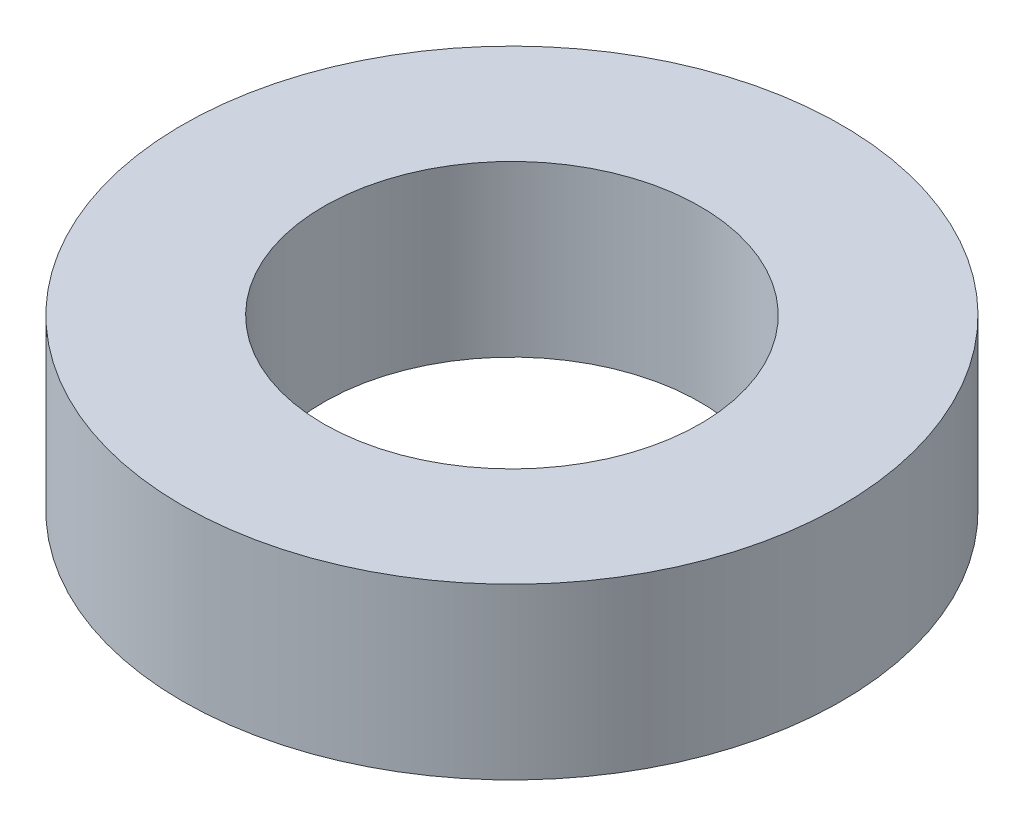
from build123d import *

# Parameters (mm, degrees)
SKETCH1_R           = 35
BOSS_EXTRUDE1_DEPTH = 18
SKETCH2_R           = 20
CUT_EXTRUDE1_DEPTH  = 53.668776329


with BuildPart() as part:
    # Sketch1 → Boss-Extrude1 (new body)
    with BuildSketch(Plane(origin=(0, 0, 0), x_dir=(1, 0, 0), z_dir=(0, 1, 0))):
        Circle(SKETCH1_R)
    extrude(amount=BOSS_EXTRUDE1_DEPTH)

    # Sketch2 → Cut-Extrude1 (cut, through all)
    with BuildSketch(Plane(origin=(0, 0, 0), x_dir=(1, 0, 0), z_dir=(0, 1, 0))):
        Circle(SKETCH2_R)
    extrude(amount=CUT_EXTRUDE1_DEPTH, mode=Mode.SUBTRACT)


solid = part.part
